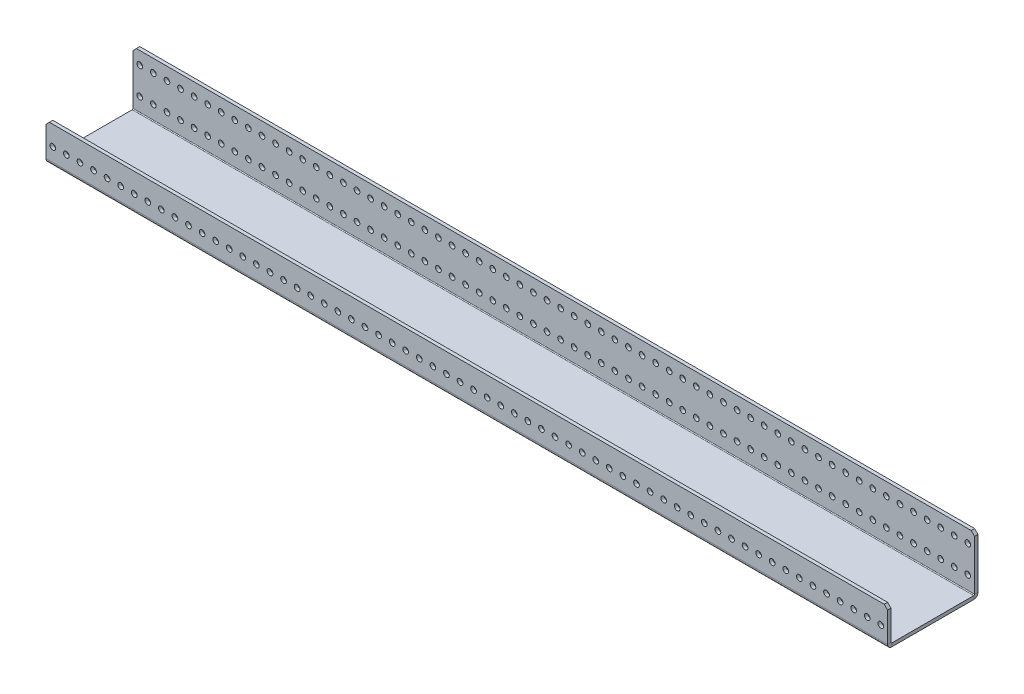
from build123d import *

# Parameters (mm, degrees)
SKETCH1_W                    = 787.4
SKETCH1_H                    = 78.232
BOSS_EXTRUDE1_DEPTH          = 3.175
EDGE_FLANGE1_STRIP_W         = 14.224
EDGE_FLANGE1_STRIP_H         = 3.175
EDGE_FLANGE1_STRIP_CUT_DEPTH = 787.4
EDGE_FLANGE1_DEPTH           = 787.4
EDGE_FLANGE2_STRIP_W         = 14.224
EDGE_FLANGE2_STRIP_H         = 3.175
EDGE_FLANGE2_STRIP_CUT_DEPTH = 787.4
EDGE_FLANGE2_DEPTH           = 787.4
SKETCH9_R                    = 2.667
CUT_EXTRUDE1_DEPTH           = 794.767078776
CHAMFER1_SIZE                = 3.175
LPATTERN1_COUNT              = 62
LPATTERN1_PITCH              = 12.7
SKETCH14_R                   = 2.667
CUT_EXTRUDE6_DEPTH           = 5.08
LPATTERN4_COUNT              = 62
LPATTERN4_PITCH              = 12.7


# Sheet-metal steps are written as plain solids
with BuildPart() as part:
    # Sketch1 → Boss-Extrude1 (new body)
    with BuildSketch(Plane(origin=(0, 0, 0), x_dir=(1, 0, 0), z_dir=(0, 1, 0))):
        with Locations((393.7, 39.116)):
            Rectangle(SKETCH1_W, SKETCH1_H)
    extrude(amount=BOSS_EXTRUDE1_DEPTH)

    # Edge-Flange1 strip (across the edge) → Edge-Flange1 strip cut (cut)
    with BuildSketch(Plane(origin=(787.4, 3.175, -78.232), x_dir=(0, 0, 1), z_dir=(-1, 0, 0))):
        with Locations((-6.35, -1.5875)):
            Rectangle(EDGE_FLANGE1_STRIP_W, EDGE_FLANGE1_STRIP_H)
    extrude(amount=EDGE_FLANGE1_STRIP_CUT_DEPTH, mode=Mode.SUBTRACT)

    # Edge-Flange1 section (across the edge) → Edge-Flange1 (add)
    with BuildSketch(Plane(origin=(787.4, 3.175, -78.232), x_dir=(0, 0, 1), z_dir=(-1, 0, 0))):
        with BuildLine():
            Line((-3.175, 0.762), (-3.175, 50.8))
            Line((-3.175, 50.8), (0, 50.8))
            Line((0, 50.8), (0, 0.762))
            ThreePointArc((0, 0.762), (0.223184633, 0.223184633), (0.762, 0))
            Line((0.762, 0), (0.762, -3.175))
            ThreePointArc((0.762, -3.175), (-2.021879398, -2.021879398), (-3.175, 0.762))
        make_face()
    extrude(amount=EDGE_FLANGE1_DEPTH)

    # Edge-Flange2 strip (across the edge) → Edge-Flange2 strip cut (cut)
    with BuildSketch(Plane(origin=(0, 3.175, 0), x_dir=(0, 0, -1), z_dir=(1, 0, 0))):
        with Locations((-6.35, -1.5875)):
            Rectangle(EDGE_FLANGE2_STRIP_W, EDGE_FLANGE2_STRIP_H)
    extrude(amount=EDGE_FLANGE2_STRIP_CUT_DEPTH, mode=Mode.SUBTRACT)

    # Edge-Flange2 section (across the edge) → Edge-Flange2 (add)
    with BuildSketch(Plane(origin=(0, 3.175, 0), x_dir=(0, 0, -1), z_dir=(1, 0, 0))):
        with BuildLine():
            Line((-3.175, 0.762), (-3.175, 31.75))
            Line((-3.175, 31.75), (0, 31.75))
            Line((0, 31.75), (0, 0.762))
            ThreePointArc((0, 0.762), (0.223184633, 0.223184633), (0.762, 0))
            Line((0.762, 0), (0.762, -3.175))
            ThreePointArc((0.762, -3.175), (-2.021879398, -2.021879398), (-3.175, 0.762))
        make_face()
    extrude(amount=EDGE_FLANGE2_DEPTH)

    # Sketch9 → Cut-Extrude1 (cut, through all)
    with BuildSketch(Plane.XY.offset(3.175)):
        with Locations((781.05, 16.637)):
            Circle(SKETCH9_R)
    cut_extrude1 = extrude(amount=-CUT_EXTRUDE1_DEPTH, mode=Mode.SUBTRACT)

    # Chamfer1
    chamfer1_edges = [part.edges().sort_by_distance(p)[0] for p in [
        (787.4, 53.975, -79.8195),
        (0, 53.975, -79.8195),
        (0, 34.925, 1.5875),
        (787.4, 34.925, 1.5875),
    ]]
    chamfer(chamfer1_edges, length=CHAMFER1_SIZE)

    # LPattern1: Cut-Extrude1 ×62
    with Locations(*[(-i * LPATTERN1_PITCH, 0, 0) for i in range(1, LPATTERN1_COUNT)]):
        add(cut_extrude1, mode=Mode.SUBTRACT)

    # Sketch14 → Cut-Extrude6 (cut)
    with BuildSketch(Plane(origin=(0, 0, -81.407), x_dir=(-1, 0, 0), z_dir=(0, 0, -1))):
        with Locations(Location((-781.05, 42.037, 0), (0, 0, 90))):
            Circle(SKETCH14_R)
    cut_extrude6 = extrude(amount=-CUT_EXTRUDE6_DEPTH, mode=Mode.SUBTRACT)

    # LPattern4: Cut-Extrude6 ×62
    with Locations(*[(-i * LPATTERN4_PITCH, 0, 0) for i in range(1, LPATTERN4_COUNT)]):
        add(cut_extrude6, mode=Mode.SUBTRACT)


solid = part.part
